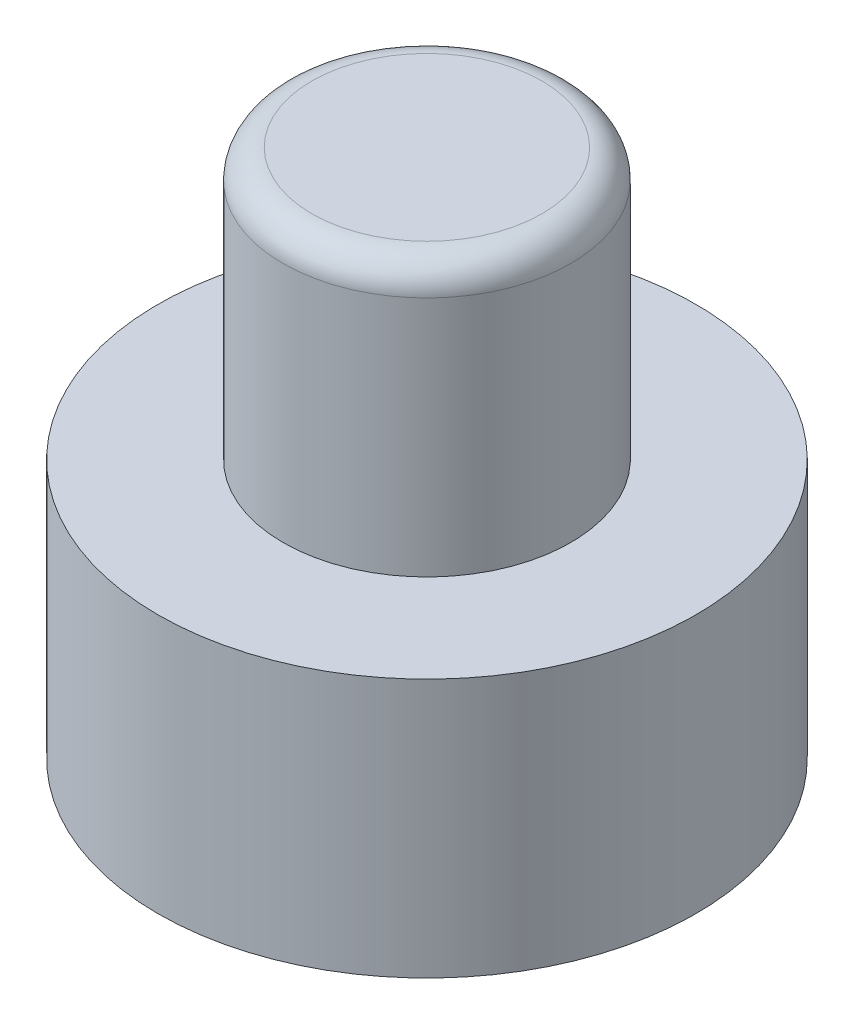
from build123d import *

# Parameters (mm, degrees)
SKETCH1_R           = 4.675
BOSS_EXTRUDE1_DEPTH = 4.5
SKETCH2_R           = 2.5
BOSS_EXTRUDE2_DEPTH = 4.7
FILLET1_R           = 0.5


with BuildPart() as part:
    # Sketch1 → Boss-Extrude1 (new body)
    with BuildSketch(Plane(origin=(0, 0, 0), x_dir=(1, 0, 0), z_dir=(0, 1, 0))):
        Circle(SKETCH1_R)
    extrude(amount=BOSS_EXTRUDE1_DEPTH)

    # Sketch2 → Boss-Extrude2 (add)
    with BuildSketch(Plane(origin=(0, 4.5, 0), x_dir=(1, 0, 0), z_dir=(0, 1, 0))):
        Circle(SKETCH2_R)
    extrude(amount=BOSS_EXTRUDE2_DEPTH)

    # Fillet1
    fillet1_edges = [part.edges().sort_by_distance(p)[0] for p in [
        (-2.5, 9.2, 0),
    ]]
    fillet(fillet1_edges, radius=FILLET1_R)


solid = part.part
